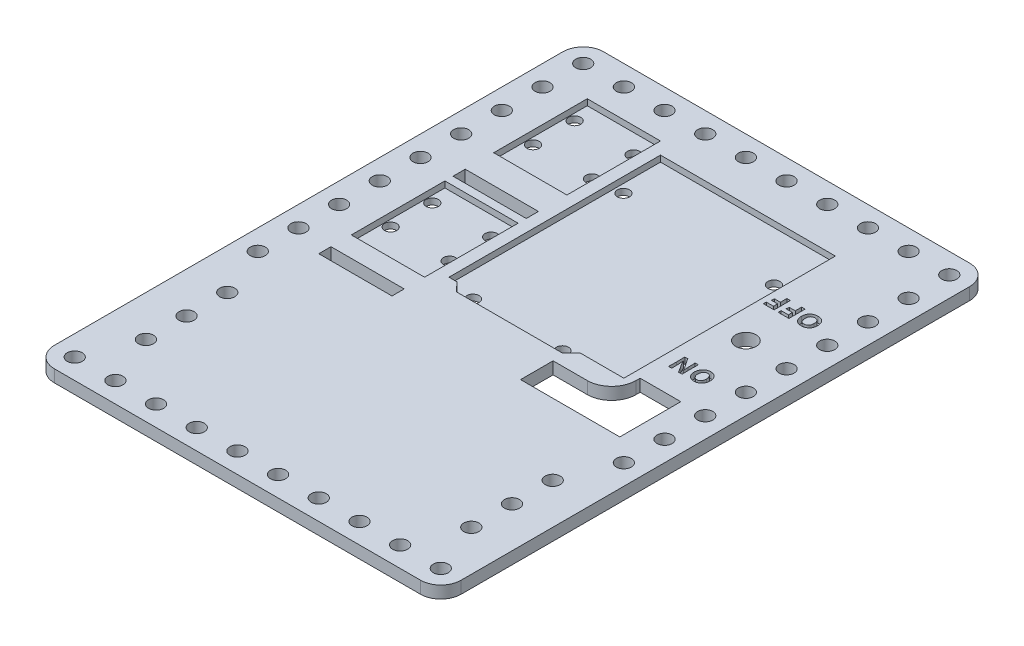
from build123d import *

# Parameters (mm, degrees)
PLATE_EXTRUDE_DEPTH               = 3.81
SKETCH2_R                         = 2.3495
OUTER_HOLE_CUT_DEPTH              = 214.397794272
SKETCH3_R                         = 1.905
ARDUINO_SHAPE_CUT_DEPTH           = 1.905
SKETCH4_W                         = 22.86
SKETCH4_H                         = 29.21
SKETCH4_R                         = 1.905
HG7881_SHAPE_CUT_DEPTH            = 1.905
SKETCH5_R                         = 1.905
ARDUINO_AND_HG7881_HOLE_CUT_DEPTH = 214.397794272
SKETCH6_R                         = 3.175
ON_OFF_TEXT_CUT_DEPTH             = 1.905
SKETCH8_R                         = 3.175
SWITCH_HOLE_CUT_DEPTH             = 214.372284013
BATTERY_WIRE_CUT_DEPTH            = 214.397794411
SKETCH10_W                        = 22.86
SKETCH10_H                        = 3.81
MOTOR_WIRE_CUT_DEPTH              = 214.397794411


with BuildPart() as part:
    # Sketch1 → Plate Extrude (new body)
    with BuildSketch(Plane(origin=(0, 0, 0), x_dir=(1, 0, 0), z_dir=(0, 1, 0))):
        with BuildLine():
            Line((6.35, 0), (120.65, 0))
            ThreePointArc((120.65, 0), (125.140128061, 1.859871939), (127, 6.35))
            Line((127, 6.35), (127, 165.1))
            ThreePointArc((127, 165.1), (125.140128061, 169.590128061), (120.65, 171.45))
            Line((120.65, 171.45), (6.35, 171.45))
            ThreePointArc((6.35, 171.45), (1.859871939, 169.590128061), (0, 165.1))
            Line((0, 165.1), (0, 6.35))
            ThreePointArc((0, 6.35), (1.859871939, 1.859871939), (6.35, 0))
        make_face()
    extrude(amount=PLATE_EXTRUDE_DEPTH)

    # Sketch2 → Outer Hole Cut (cut, through all)
    with BuildSketch(Plane(origin=(0, 3.81, 0), x_dir=(1, 0, 0), z_dir=(0, 1, 0))):
        with Locations((6.35, 165.1)):
            Circle(SKETCH2_R)
        with Locations((19.05, 165.1)):
            Circle(SKETCH2_R)
        with Locations((31.75, 165.1)):
            Circle(SKETCH2_R)
        with Locations((44.45, 165.1)):
            Circle(SKETCH2_R)
        with Locations((57.15, 165.1)):
            Circle(SKETCH2_R)
        with Locations((69.85, 165.1)):
            Circle(SKETCH2_R)
        with Locations((82.55, 165.1)):
            Circle(SKETCH2_R)
        with Locations((95.25, 165.1)):
            Circle(SKETCH2_R)
        with Locations((107.95, 165.1)):
            Circle(SKETCH2_R)
        with Locations((120.65, 165.1)):
            Circle(SKETCH2_R)
        with Locations((6.35, 152.4)):
            Circle(SKETCH2_R)
        with Locations((120.65, 152.4)):
            Circle(SKETCH2_R)
        with Locations((6.35, 139.7)):
            Circle(SKETCH2_R)
        with Locations((120.65, 139.7)):
            Circle(SKETCH2_R)
        with Locations((6.35, 127)):
            Circle(SKETCH2_R)
        with Locations((120.65, 127)):
            Circle(SKETCH2_R)
        with Locations((6.35, 114.3)):
            Circle(SKETCH2_R)
        with Locations((120.65, 114.3)):
            Circle(SKETCH2_R)
        with Locations((6.35, 101.6)):
            Circle(SKETCH2_R)
        with Locations((120.65, 101.6)):
            Circle(SKETCH2_R)
        with Locations((6.35, 88.9)):
            Circle(SKETCH2_R)
        with Locations((120.65, 88.9)):
            Circle(SKETCH2_R)
        with Locations((6.35, 76.2)):
            Circle(SKETCH2_R)
        with Locations((120.65, 76.2)):
            Circle(SKETCH2_R)
        with Locations((6.35, 63.5)):
            Circle(SKETCH2_R)
        with Locations((120.65, 63.5)):
            Circle(SKETCH2_R)
        with Locations((6.35, 6.35)):
            Circle(SKETCH2_R)
        with Locations((19.05, 6.35)):
            Circle(SKETCH2_R)
        with Locations((31.75, 6.35)):
            Circle(SKETCH2_R)
        with Locations((44.45, 6.35)):
            Circle(SKETCH2_R)
        with Locations((57.15, 6.35)):
            Circle(SKETCH2_R)
        with Locations((69.85, 6.35)):
            Circle(SKETCH2_R)
        with Locations((82.55, 6.35)):
            Circle(SKETCH2_R)
        with Locations((95.25, 6.35)):
            Circle(SKETCH2_R)
        with Locations((107.95, 6.35)):
            Circle(SKETCH2_R)
        with Locations((120.65, 6.35)):
            Circle(SKETCH2_R)
        with Locations((12.7, 22.225)):
            Circle(SKETCH2_R)
        with Locations((12.7, 34.925)):
            Circle(SKETCH2_R)
        with Locations((12.7, 47.625)):
            Circle(SKETCH2_R)
        with Locations((114.3, 47.625)):
            Circle(SKETCH2_R)
        with Locations((114.3, 34.925)):
            Circle(SKETCH2_R)
        with Locations((114.3, 22.225)):
            Circle(SKETCH2_R)
    extrude(amount=-OUTER_HOLE_CUT_DEPTH, mode=Mode.SUBTRACT)

    # Sketch3 → Arduino Shape Cut (cut)
    with BuildSketch(Plane(origin=(0, 3.81, 0), x_dir=(1, 0, 0), z_dir=(0, 1, 0))):
        Polygon((48.26, 83.566), (81.28, 83.566), (84.074, 86.36), (97.79, 86.36), (97.79, 152.4), (43.18, 152.4), (43.18, 86.36), (45.72, 86.36), align=None)
        with Locations((50.927, 86.106)):
            Circle(SKETCH3_R, mode=Mode.SUBTRACT)
        with Locations((78.867, 86.106)):
            Circle(SKETCH3_R, mode=Mode.SUBTRACT)
        with Locations((45.847, 138.176)):
            Circle(SKETCH3_R, mode=Mode.SUBTRACT)
        with Locations((94.107, 136.906)):
            Circle(SKETCH3_R, mode=Mode.SUBTRACT)
    extrude(amount=-ARDUINO_SHAPE_CUT_DEPTH, mode=Mode.SUBTRACT)

    # Sketch4 → HG7881 Shape Cut (cut)
    # profile 1 of 2: a face of its own
    with BuildSketch(Plane(origin=(0, 3.81, 0), x_dir=(1, 0, 0), z_dir=(0, 1, 0))):
        with Locations((27.94, 141.605)):
            Rectangle(SKETCH4_W, SKETCH4_H)
        with Locations((18.605695933, 137.183397888)):
            Circle(SKETCH4_R, mode=Mode.SUBTRACT)
        with Locations((18.605695933, 150.182885458)):
            Circle(SKETCH4_R, mode=Mode.SUBTRACT)
        with Locations((37.004970647, 137.183397888)):
            Circle(SKETCH4_R, mode=Mode.SUBTRACT)
        with Locations((37.004970647, 150.182885458)):
            Circle(SKETCH4_R, mode=Mode.SUBTRACT)
    # profile 2 of 2: a face of its own
    with BuildSketch(Plane(origin=(0, 3.81, 0), x_dir=(1, 0, 0), z_dir=(0, 1, 0))):
        with Locations((27.94, 97.155)):
            Rectangle(SKETCH4_W, SKETCH4_H)
        with Locations((18.605695933, 92.733397888)):
            Circle(SKETCH4_R, mode=Mode.SUBTRACT)
        with Locations((18.605695933, 105.732885458)):
            Circle(SKETCH4_R, mode=Mode.SUBTRACT)
        with Locations((37.004970647, 92.733397888)):
            Circle(SKETCH4_R, mode=Mode.SUBTRACT)
        with Locations((37.004970647, 105.732885458)):
            Circle(SKETCH4_R, mode=Mode.SUBTRACT)
    extrude(amount=-HG7881_SHAPE_CUT_DEPTH, mode=Mode.SUBTRACT)

    # Sketch5 → Arduino and HG7881 Hole Cut (cut, through all)
    with BuildSketch(Plane(origin=(0, 3.81, 0), x_dir=(1, 0, 0), z_dir=(0, 1, 0))):
        with Locations((94.107, 136.906)):
            Circle(SKETCH5_R)
        with Locations((78.867, 86.106)):
            Circle(SKETCH5_R)
        with Locations((50.927, 86.106)):
            Circle(SKETCH5_R)
        with Locations((45.847, 138.176)):
            Circle(SKETCH5_R)
        with Locations((18.605695933, 150.182885458)):
            Circle(SKETCH5_R)
        with Locations((37.004970647, 150.182885458)):
            Circle(SKETCH5_R)
        with Locations((37.004970647, 137.183397888)):
            Circle(SKETCH5_R)
        with Locations((18.605695933, 137.183397888)):
            Circle(SKETCH5_R)
        with Locations((18.605695933, 105.732885458)):
            Circle(SKETCH5_R)
        with Locations((18.605695933, 92.733397888)):
            Circle(SKETCH5_R)
        with Locations((37.004970647, 92.733397888)):
            Circle(SKETCH5_R)
        with Locations((37.004970647, 105.732885458)):
            Circle(SKETCH5_R)
    extrude(amount=-ARDUINO_AND_HG7881_HOLE_CUT_DEPTH, mode=Mode.SUBTRACT)

    # Sketch6 → On-Off Text Cut (cut)
    # profile 1 of 6: a face of its own
    with BuildSketch(Plane(origin=(0, 3.81, 0), x_dir=(1, 0, 0), z_dir=(0, 1, 0))):
        with Locations((106.68, 115.57)):
            Circle(SKETCH6_R)
    # profile 2 of 6: a face of its own
    with BuildSketch(Plane(origin=(0, 3.81, 0), x_dir=(1, 0, 0), z_dir=(0, 1, 0))):
        Polygon((99.437371429, 129.171473214), (101.693889286, 129.171473214), (101.693889286, 130.447142857), (99.727657143, 130.447142857), (99.853523214, 131.340678571), (101.693889286, 131.340678571), (101.693889286, 133.35), (102.775657143, 133.35), (102.775657143, 128.27), (99.437371429, 128.27), align=None)
    # profile 3 of 6: a face of its own
    with BuildSketch(Plane(origin=(0, 3.81, 0), x_dir=(1, 0, 0), z_dir=(0, 1, 0))):
        Polygon((104.067428571, 129.171473214), (106.323946429, 129.171473214), (106.323946429, 130.447142857), (104.357714286, 130.447142857), (104.483580357, 131.340678571), (106.323946429, 131.340678571), (106.323946429, 133.35), (107.405714286, 133.35), (107.405714286, 128.27), (104.067428571, 128.27), align=None)
    # profile 4 of 6: a face of its own
    with BuildSketch(Plane(origin=(0, 3.81, 0), x_dir=(1, 0, 0), z_dir=(0, 1, 0))):
        with BuildLine():
            add(Edge.make_bspline(
                [(111.333869643, 133.422571429), (111.400036429, 133.421293644), (111.530264052, 133.418778743), (111.721599638, 133.404606211), (111.905189704, 133.378126371), (112.080972714, 133.342085434), (112.249811922, 133.295795244), (112.410188822, 133.237757182), (112.56375482, 133.170889374), (112.708490415, 133.092309384), (112.845717814, 133.005237576), (112.974334881, 132.909432457), (113.094740592, 132.806319468), (113.206712713, 132.694912539), (113.308131412, 132.57405969), (113.403356697, 132.446908184), (113.488212662, 132.310484017), (113.563748165, 132.16604788), (113.632281169, 132.015770277), (113.689480318, 131.858408066), (113.739904415, 131.695888569), (113.780829795, 131.527040484), (113.81070706, 131.351870875), (113.83367303, 131.171457432), (113.847541782, 130.984842805), (113.849209369, 130.858404304), (113.850057143, 130.794125)],
                knots=[0, 0, 0, 0, 1.155951806, 2.27511212, 3.348946555, 4.393954723, 5.407965168, 6.404192186, 7.370925071, 8.331051299, 9.278033103, 10.207707961, 11.130132865, 12.045226557, 12.963364229, 13.883801961, 14.818154459, 15.766240508, 16.729630475, 17.701042071, 18.688919443, 19.701036391, 20.733368675, 21.791477785, 22.87722277, 24, 24, 24, 24], degree=3))
            add(Edge.make_bspline(
                [(113.850057143, 130.794125), (113.848906268, 130.723415676), (113.846650783, 130.584839579), (113.830807146, 130.381464541), (113.803655066, 130.186799958), (113.765464041, 130.000674458), (113.715246029, 129.823531722), (113.655605416, 129.654880626), (113.583465924, 129.495671763), (113.50234301, 129.345001737), (113.41108714, 129.204043311), (113.31226795, 129.072453114), (113.206641733, 128.94927541), (113.093327301, 128.835899312), (112.972520145, 128.732371499), (112.845157245, 128.638101242), (112.711122269, 128.552318363), (112.569123876, 128.478021474), (112.421764909, 128.412826257), (112.27068682, 128.354325345), (112.115299257, 128.305849976), (111.955941564, 128.265946605), (111.79235473, 128.23525646), (111.624564852, 128.214361204), (111.453183056, 128.19989699), (111.337679665, 128.198255989), (111.279441071, 128.197428571)],
                knots=[0, 0, 0, 0, 1.232878784, 2.416195216, 3.554230057, 4.658068463, 5.726311703, 6.762375074, 7.774173883, 8.770921373, 9.743472943, 10.699106932, 11.638420552, 12.570469205, 13.491194589, 14.409936463, 15.331416347, 16.263022172, 17.201202179, 18.139983866, 19.086323116, 20.037401017, 21.002982729, 21.986393442, 22.984708488, 24, 24, 24, 24], degree=3))
            add(Edge.make_bspline(
                [(111.279441071, 128.197428571), (111.213273297, 128.198699923), (111.083043727, 128.201202161), (110.891348755, 128.215493951), (110.707341451, 128.241734867), (110.531225731, 128.277979812), (110.362636424, 128.323918585), (110.20258477, 128.382788307), (110.048654743, 128.44877322), (109.903698075, 128.527726294), (109.766481954, 128.614787794), (109.637970949, 128.710263657), (109.518441812, 128.813624609), (109.408232239, 128.925490711), (109.305412098, 129.044563325), (109.21296982, 129.172923095), (109.128308478, 129.308838983), (109.052681555, 129.452532716), (108.985946638, 129.603423069), (108.927838811, 129.760537247), (108.879184775, 129.923835762), (108.840002216, 130.093242837), (108.807409716, 130.267881714), (108.786989966, 130.448664016), (108.772427389, 130.635137343), (108.770856008, 130.761589005), (108.770057143, 130.825875)],
                knots=[0, 0, 0, 0, 1.156696468, 2.276577743, 3.357644939, 4.403326298, 5.417989967, 6.408643156, 7.382049269, 8.342794008, 9.290385856, 10.22065961, 11.138675759, 12.049699079, 12.963401745, 13.885853181, 14.811705546, 15.76040235, 16.721714871, 17.693752249, 18.686672155, 19.697909826, 20.732068579, 21.790055059, 22.876499479, 24, 24, 24, 24], degree=3))
            add(Edge.make_bspline(
                [(108.770057143, 130.825875), (108.771206464, 130.89658476), (108.773458903, 131.035161713), (108.789324398, 131.238530612), (108.816397961, 131.433217244), (108.854774203, 131.618807699), (108.903794309, 131.795669576), (108.962645033, 131.964126231), (109.032386679, 132.12416686), (109.115110349, 132.274202466), (109.205284266, 132.415500429), (109.303290757, 132.547534618), (109.407831218, 132.670641911), (109.519985995, 132.784493228), (109.640747152, 132.887192812), (109.767111148, 132.982279292), (109.901099061, 133.067622997), (110.043041207, 133.141992923), (110.190413589, 133.207175556), (110.341494872, 133.265652887), (110.497206242, 133.314345793), (110.65703301, 133.353892206), (110.82058586, 133.384658176), (110.987980111, 133.405720988), (111.159372037, 133.420122315), (111.275253204, 133.421748733), (111.333869643, 133.422571429)],
                knots=[0, 0, 0, 0, 1.233852716, 2.418103927, 3.557037776, 4.661748176, 5.722706476, 6.757383218, 7.77332691, 8.765066384, 9.743935184, 10.696381236, 11.632146327, 12.56027906, 13.481731785, 14.395908616, 15.318116437, 16.250458198, 17.189379335, 18.128902627, 19.075989452, 20.034218859, 21.000563348, 21.978209187, 22.977312867, 24, 24, 24, 24], degree=3))
        make_face()
        with BuildLine():
            add(Edge.make_bspline(
                [(111.333869643, 132.513160714), (111.260356697, 132.511022486), (111.117541046, 132.506868489), (110.912228262, 132.467444284), (110.723064955, 132.404073163), (110.552376597, 132.313848715), (110.39951417, 132.200857268), (110.267975467, 132.064006418), (110.156626043, 131.905342044), (110.067891131, 131.725106566), (109.998896762, 131.526104278), (109.949508152, 131.310172001), (109.919816656, 131.076918765), (109.916108454, 130.915923571), (109.914191071, 130.832678571)],
                knots=[0, 0, 0, 0, 1.058829075, 2.057016769, 3.001336896, 3.925137105, 4.828608669, 5.730369611, 6.649529683, 7.612114954, 8.616840434, 9.679574342, 10.800188823, 12, 12, 12, 12], degree=3))
            add(Edge.make_bspline(
                [(109.914191071, 130.832678571), (109.915327037, 130.766878559), (109.917543635, 130.638483618), (109.933372092, 130.451336623), (109.959899959, 130.275341088), (109.999263424, 130.110717595), (110.046800586, 129.956526213), (110.107502436, 129.814047056), (110.178016873, 129.682400803), (110.259208826, 129.562263883), (110.351555025, 129.454397682), (110.455050487, 129.361321652), (110.568103557, 129.282339821), (110.691217371, 129.218037433), (110.82431679, 129.168601217), (110.967126702, 129.132058011), (111.120015541, 129.110232066), (111.225317862, 129.107991097), (111.279441071, 129.106839286)],
                knots=[0, 0, 0, 0, 1.264720188, 2.467836498, 3.607410022, 4.682410581, 5.718732818, 6.705184373, 7.654411213, 8.585417356, 9.486955331, 10.37694296, 11.253694391, 12.131137943, 13.039326412, 13.976802171, 14.960118255, 16, 16, 16, 16], degree=3))
            add(Edge.make_bspline(
                [(111.279441071, 129.106839286), (111.335835439, 129.107963805), (111.445660251, 129.110153743), (111.605130658, 129.132397386), (111.754467825, 129.1672814), (111.893827821, 129.215550644), (112.021826029, 129.279882734), (112.139532644, 129.357423365), (112.247188969, 129.448928353), (112.343643179, 129.554712323), (112.427774366, 129.673333586), (112.504124023, 129.800646126), (112.565732047, 129.940530934), (112.618197887, 130.089703369), (112.65751171, 130.249670935), (112.685693127, 130.419482433), (112.702863689, 130.59986961), (112.704886161, 130.723782964), (112.705923214, 130.787321429)],
                knots=[0, 0, 0, 0, 1.08085409, 2.104901632, 3.080636972, 4.018233257, 4.92584896, 5.820434128, 6.715107381, 7.628320538, 8.557700034, 9.499963439, 10.469947595, 11.483138428, 12.529113844, 13.62418888, 14.781766574, 16, 16, 16, 16], degree=3))
            add(Edge.make_bspline(
                [(112.705923214, 130.787321429), (112.704776361, 130.853119363), (112.702538517, 130.981510249), (112.686892008, 131.168313502), (112.659874426, 131.344207167), (112.621276707, 131.508645576), (112.57302335, 131.662624589), (112.512522447, 131.805334763), (112.441448923, 131.936960635), (112.359415567, 132.056716931), (112.267521316, 132.164582447), (112.163536671, 132.257359514), (112.051058988, 132.33815621), (111.926516373, 132.401844476), (111.79240037, 132.451433345), (111.648432164, 132.48792879), (111.494425971, 132.509768601), (111.388370919, 132.512009252), (111.333869643, 132.513160714)],
                knots=[0, 0, 0, 0, 1.261902195, 2.462337776, 3.592208748, 4.671870648, 5.698974068, 6.683227656, 7.640165232, 8.563109179, 9.462638388, 10.350642987, 11.229606108, 12.111523837, 13.024477649, 13.966889128, 14.955192282, 16, 16, 16, 16], degree=3))
        make_face(mode=Mode.SUBTRACT)
    # profile 5 of 6: a face of its own
    with BuildSketch(Plane(origin=(0, 3.81, 0), x_dir=(1, 0, 0), z_dir=(0, 1, 0))):
        with BuildLine():
            Line((101.571701087, 101.6), (102.551809783, 101.6))
            add(Edge.make_bspline(
                [(102.551809783, 101.6), (102.553079155, 101.591496576), (102.556215841, 101.570484157), (102.570664261, 101.534679948), (102.591082833, 101.487804539), (102.620097882, 101.430079145), (102.658760832, 101.362405041), (102.704449364, 101.283213598), (102.758562728, 101.193253978), (102.822069529, 101.093545151), (102.893671719, 100.982906434), (102.972802487, 100.86119078), (103.060135034, 100.728571416), (103.157336197, 100.586182156), (103.261555818, 100.432102311), (103.374428056, 100.267691579), (103.495412933, 100.092321927), (103.579399973, 99.972190914), (103.622797101, 99.910117754)],
                knots=[0, 0, 0, 0, 0.205231542, 0.507138232, 0.918114075, 1.43119293, 2.051657812, 2.783675886, 3.619500081, 4.564189586, 5.613081396, 6.773937471, 8.039102956, 9.413756019, 10.900431551, 12.49155187, 14.187142031, 16, 16, 16, 16], degree=3))
            add(Edge.make_bspline(
                [(103.622797101, 99.910117754), (103.668479586, 99.844199803), (103.757538516, 99.715691422), (103.887173245, 99.526789572), (104.007406999, 99.344779881), (104.121663036, 99.171557745), (104.227239447, 99.00548474), (104.32653222, 98.848337094), (104.417180624, 98.69839973), (104.50147074, 98.557301325), (104.577616504, 98.423347164), (104.64618625, 98.297520821), (104.708125137, 98.17985106), (104.760131227, 98.06952422), (104.807399208, 97.968188192), (104.844718413, 97.873750658), (104.876811856, 97.787843498), (104.892374368, 97.73220927), (104.899699275, 97.706023551)],
                knots=[0, 0, 0, 0, 1.506314367, 2.936590399, 4.302859661, 5.603249387, 6.833922843, 7.998884892, 9.094460789, 10.124569346, 11.085756043, 11.988160505, 12.816011405, 13.582674735, 14.278848772, 14.915439517, 15.489522948, 16, 16, 16, 16], degree=3))
            Line((104.899699275, 97.706023551), (104.961818841, 97.706023551))
            add(Edge.make_bspline(
                [(104.961818841, 97.706023551), (104.946818759, 97.845142891), (104.917636661, 98.115794366), (104.888472357, 98.512507451), (104.868464415, 98.888388717), (104.866259214, 99.132448729), (104.865188406, 99.250960145)],
                knots=[0, 0, 0, 0, 1.084104681, 2.109085131, 3.081803711, 4, 4, 4, 4], degree=3))
            add(Edge.make_bspline(
                [(104.865188406, 99.250960145), (104.864853394, 99.333402876), (104.864164663, 99.502892231), (104.86216003, 99.763653748), (104.857114562, 100.03781533), (104.851426739, 100.324640397), (104.844712712, 100.624901996), (104.835498142, 100.938190599), (104.823697584, 101.264872429), (104.81536631, 101.486882095), (104.811121377, 101.6)],
                knots=[0, 0, 0, 0, 0.842047515, 1.73111792, 2.663366491, 3.642676722, 4.661226829, 5.730878757, 6.843842049, 8, 8, 8, 8], degree=3))
            Line((104.811121377, 101.6), (105.807335145, 101.6))
            add(Edge.make_bspline(
                [(105.807335145, 101.6), (105.798340153, 101.393721964), (105.779902851, 100.97090777), (105.762420775, 100.32164218), (105.750178227, 99.642130778), (105.749177957, 99.179260189), (105.748666667, 98.942663043)],
                knots=[0, 0, 0, 0, 0.932070356, 1.910492186, 2.931944271, 4, 4, 4, 4], degree=3))
            add(Edge.make_bspline(
                [(105.748666667, 98.942663043), (105.748984022, 98.826092785), (105.749606211, 98.597551705), (105.751641037, 98.261636471), (105.756127683, 97.939137711), (105.763446337, 97.629703228), (105.770883425, 97.333256256), (105.781762949, 97.050292055), (105.792621981, 96.7806676), (105.802509207, 96.60549933), (105.807335145, 96.52)],
                knots=[0, 0, 0, 0, 1.154308935, 2.263073052, 3.326355064, 4.348015109, 5.328014083, 6.262712885, 7.152033157, 8, 8, 8, 8], degree=3))
            Line((105.807335145, 96.52), (104.613259058, 96.52))
            add(Edge.make_bspline(
                [(104.613259058, 96.52), (104.612465362, 96.530419236), (104.610608174, 96.554799443), (104.59732357, 96.594910597), (104.578967095, 96.644919777), (104.552277637, 96.704417668), (104.517132948, 96.773334817), (104.476051736, 96.852518395), (104.427307278, 96.941471412), (104.371588344, 97.04004313), (104.305826779, 97.147160894), (104.235690568, 97.265215372), (104.156690224, 97.392294054), (104.070432637, 97.529202621), (103.976568865, 97.675742049), (103.874805245, 97.831716708), (103.765421388, 97.997051653), (103.690272663, 98.110942949), (103.651556159, 98.169619565)],
                knots=[0, 0, 0, 0, 0.260950452, 0.610603898, 1.051316961, 1.597493103, 2.241864315, 2.989446012, 3.831961201, 4.782733297, 5.825518036, 6.980323617, 8.222547723, 9.573714243, 11.0339099, 12.581861888, 14.238980645, 16, 16, 16, 16], degree=3))
            add(Edge.make_bspline(
                [(103.651556159, 98.169619565), (103.610117445, 98.232105071), (103.528884883, 98.354595784), (103.410343654, 98.534293609), (103.300245503, 98.707563793), (103.195313826, 98.871665753), (103.097309299, 99.028369859), (103.006451259, 99.17733733), (102.923526743, 99.319626396), (102.846878643, 99.4534804), (102.776017402, 99.579270576), (102.712927248, 99.697504243), (102.656465292, 99.808486231), (102.60556953, 99.911165603), (102.562908939, 100.006864384), (102.5276216, 100.094608093), (102.496298031, 100.173696677), (102.481645329, 100.2251912), (102.474735507, 100.249474638)],
                knots=[0, 0, 0, 0, 1.50202595, 2.944430501, 4.312466267, 5.614511466, 6.846487252, 8.015042657, 9.109869109, 10.145562719, 11.105070242, 12.002023666, 12.829975823, 13.599528891, 14.297593606, 14.928102942, 15.494522073, 16, 16, 16, 16], degree=3))
            Line((102.474735507, 100.249474638), (102.416067029, 100.249474638))
            add(Edge.make_bspline(
                [(102.416067029, 100.249474638), (102.430056431, 100.108414982), (102.457289954, 99.833810564), (102.487565511, 99.432679123), (102.505575403, 99.053649821), (102.508047596, 98.808471711), (102.509246377, 98.689583333)],
                knots=[0, 0, 0, 0, 1.088029335, 2.118094371, 3.087452347, 4, 4, 4, 4], degree=3))
            add(Edge.make_bspline(
                [(102.509246377, 98.689583333), (102.509877649, 98.512037829), (102.511147116, 98.155000068), (102.522576159, 97.615854502), (102.537410559, 97.070092516), (102.554647542, 96.704034859), (102.563313406, 96.52)],
                knots=[0, 0, 0, 0, 0.981596616, 1.973956248, 2.981409976, 4, 4, 4, 4], degree=3))
            Line((102.563313406, 96.52), (101.571701087, 96.52))
            add(Edge.make_bspline(
                [(101.571701087, 96.52), (101.576027919, 96.603204113), (101.584939241, 96.774567039), (101.596554769, 97.039140764), (101.60571566, 97.319079444), (101.612252482, 97.61436467), (101.617973851, 97.924964695), (101.622897424, 98.250514409), (101.624806496, 98.591417), (101.625442679, 98.823792243), (101.625768116, 98.942663043)],
                knots=[0, 0, 0, 0, 0.825064104, 1.699259727, 2.622494583, 3.598657128, 4.624093957, 5.698826761, 6.822842305, 8, 8, 8, 8], degree=3))
            add(Edge.make_bspline(
                [(101.625768116, 98.942663043), (101.625439879, 99.063451119), (101.624790694, 99.302344985), (101.622868855, 99.656284206), (101.617901772, 100.001772538), (101.612213155, 100.338064097), (101.605568015, 100.665936849), (101.596431747, 100.984984082), (101.58474268, 101.295568541), (101.57600477, 101.49953862), (101.571701087, 101.6)],
                knots=[0, 0, 0, 0, 1.090597418, 2.156976447, 3.195727742, 4.210299034, 5.193782273, 6.156671367, 7.092105371, 8, 8, 8, 8], degree=3))
        make_face()
    # profile 6 of 6: a face of its own
    with BuildSketch(Plane(origin=(0, 3.81, 0), x_dir=(1, 0, 0), z_dir=(0, 1, 0))):
        with BuildLine():
            add(Edge.make_bspline(
                [(107.095971014, 98.956467391), (107.098038545, 99.052446973), (107.102088355, 99.240448563), (107.138082301, 99.515939157), (107.193530585, 99.779184697), (107.273236891, 100.030087927), (107.375994757, 100.268320132), (107.501995101, 100.493864353), (107.651373954, 100.706114628), (107.820705927, 100.904265075), (108.007386293, 101.083919763), (108.206322554, 101.242452231), (108.417086875, 101.375664025), (108.638286754, 101.484061209), (108.869511295, 101.570671222), (109.112575111, 101.629117994), (109.365913652, 101.668029128), (109.538807038, 101.671736851), (109.626768116, 101.673623188)],
                knots=[0, 0, 0, 0, 1.110003907, 2.174238483, 3.208849045, 4.21905918, 5.214618782, 6.205710215, 7.202652759, 8.212697272, 9.216731802, 10.195754822, 11.150873912, 12.095299873, 13.041381198, 14.001176956, 14.983080657, 16, 16, 16, 16], degree=3))
            add(Edge.make_bspline(
                [(109.626768116, 101.673623188), (109.710450436, 101.67126115), (109.874611999, 101.666627483), (110.11620657, 101.634587984), (110.346559347, 101.577214136), (110.567847064, 101.501045142), (110.776766692, 101.399360337), (110.976892254, 101.278150592), (111.164992241, 101.132493086), (111.341549596, 100.967098214), (111.503290126, 100.78577192), (111.644071043, 100.589318141), (111.763377018, 100.381245359), (111.860323823, 100.160922666), (111.936749287, 99.928707048), (111.990199949, 99.68394521), (112.023329869, 99.427495515), (112.026904388, 99.252596352), (112.028724638, 99.163532609)],
                knots=[0, 0, 0, 0, 1.033665759, 2.02776626, 3.003104485, 3.961843007, 4.913063737, 5.867569035, 6.847164971, 7.845813918, 8.852406623, 9.843523595, 10.825829756, 11.809813192, 12.811882314, 13.84042391, 14.90028102, 16, 16, 16, 16], degree=3))
            add(Edge.make_bspline(
                [(112.028724638, 99.163532609), (112.026654832, 99.067553968), (112.022600566, 98.87955422), (111.986638688, 98.604050364), (111.931073788, 98.34085305), (111.851742806, 98.089629553), (111.747359185, 97.851903249), (111.621419336, 97.626527521), (111.473523632, 97.413134279), (111.302745322, 97.21611659), (111.11629601, 97.036424917), (110.918261692, 96.877197339), (110.707571291, 96.744385705), (110.486418908, 96.635925511), (110.255181633, 96.549332393), (110.01212129, 96.490881013), (109.758781803, 96.451971134), (109.585888547, 96.448263237), (109.497927536, 96.446376812)],
                knots=[0, 0, 0, 0, 1.110098043, 2.174422874, 3.209121177, 4.219416985, 5.216829017, 6.208004501, 7.202491216, 8.215511247, 9.219630926, 10.195262581, 11.150462672, 12.094968727, 13.041130286, 14.001007442, 14.982994415, 16, 16, 16, 16], degree=3))
            add(Edge.make_bspline(
                [(109.497927536, 96.446376812), (109.414232424, 96.448691985), (109.250045767, 96.453233713), (109.008722487, 96.485926215), (108.777662801, 96.540848428), (108.557406356, 96.619607709), (108.347408432, 96.719440413), (108.147289323, 96.840145055), (107.959300855, 96.985948763), (107.781949856, 97.149815983), (107.621521036, 97.332380171), (107.480591086, 97.528332009), (107.36101928, 97.736713532), (107.264644742, 97.957662188), (107.187901159, 98.19012347), (107.134508425, 98.434909694), (107.101312679, 98.69173367), (107.097775861, 98.867018918), (107.095971014, 98.956467391)],
                knots=[0, 0, 0, 0, 1.03332865, 2.027104945, 3.001009176, 3.961012778, 4.909881577, 5.86812026, 6.840757482, 7.842544561, 8.845673591, 9.83646733, 10.818453131, 11.806448221, 12.808190538, 13.836396696, 14.895908154, 16, 16, 16, 16], degree=3))
        make_face()
        with BuildLine():
            add(Edge.make_bspline(
                [(108.200318841, 99.072653986), (108.201145221, 99.009321516), (108.202762148, 98.88540281), (108.223497198, 98.704818594), (108.25354153, 98.532915858), (108.299021078, 98.370788366), (108.355091262, 98.216915786), (108.424111107, 98.071978993), (108.507754565, 97.937496036), (108.601119268, 97.811828633), (108.706050946, 97.700577684), (108.81481794, 97.599875403), (108.932058338, 97.51696717), (109.054583796, 97.448374478), (109.183181397, 97.395196068), (109.317382772, 97.356774682), (109.457719058, 97.334939155), (109.55307205, 97.331566546), (109.601460145, 97.329855072)],
                knots=[0, 0, 0, 0, 1.216831025, 2.380897632, 3.489863252, 4.568249152, 5.613058355, 6.635127305, 7.647796248, 8.653249441, 9.639055523, 10.583653087, 11.497967932, 12.392213231, 13.277910895, 14.16691524, 15.069777711, 16, 16, 16, 16], degree=3))
            add(Edge.make_bspline(
                [(109.601460145, 97.329855072), (109.64679202, 97.331546544), (109.736067049, 97.33487767), (109.867556137, 97.357039364), (109.993754361, 97.394919169), (110.113665774, 97.449973662), (110.229168689, 97.518273516), (110.338433898, 97.603298967), (110.44349769, 97.702455009), (110.541400243, 97.81625829), (110.632395364, 97.940526288), (110.710195421, 98.075473123), (110.77649153, 98.218287435), (110.829971606, 98.369030326), (110.873206772, 98.527329378), (110.90229184, 98.69371901), (110.921593588, 98.867816853), (110.923436713, 98.986705855), (110.924376812, 99.047346014)],
                knots=[0, 0, 0, 0, 0.902754371, 1.777853262, 2.647603904, 3.519196709, 4.399346334, 5.314325575, 6.270542111, 7.272042485, 8.300124669, 9.333610479, 10.368928787, 11.43182187, 12.515581422, 13.63309649, 14.792744455, 16, 16, 16, 16], degree=3))
            add(Edge.make_bspline(
                [(110.924376812, 99.047346014), (110.922890884, 99.110270005), (110.919985047, 99.233322289), (110.901942481, 99.413871333), (110.869414521, 99.58486791), (110.826126597, 99.747654441), (110.768440125, 99.900896557), (110.69784744, 100.045018845), (110.616239973, 100.181036714), (110.520680169, 100.305466125), (110.4168244, 100.418302803), (110.307552117, 100.518994035), (110.19003061, 100.601713497), (110.068403664, 100.671539356), (109.940046696, 100.724995091), (109.806514514, 100.763051216), (109.666610731, 100.78515617), (109.571627955, 100.788461107), (109.523235507, 100.790144928)],
                knots=[0, 0, 0, 0, 1.210797462, 2.3677995, 3.486359933, 4.556649632, 5.604971398, 6.631173242, 7.640905167, 8.651714714, 9.643826094, 10.589272684, 11.504409335, 12.403069749, 13.282752155, 14.172555557, 15.068941607, 16, 16, 16, 16], degree=3))
            add(Edge.make_bspline(
                [(109.523235507, 100.790144928), (109.477885611, 100.788575032), (109.388509854, 100.785481075), (109.25721709, 100.761543515), (109.131274097, 100.72365991), (109.010381748, 100.670490971), (108.895916544, 100.600283922), (108.786225714, 100.515639957), (108.680875107, 100.416284035), (108.583244276, 100.301420209), (108.492984855, 100.176354764), (108.414095768, 100.042076018), (108.348541301, 99.899657941), (108.294464684, 99.749534016), (108.251534823, 99.591502598), (108.222390923, 99.425135539), (108.203147639, 99.251413094), (108.201272365, 99.132909644), (108.200318841, 99.072653986)],
                knots=[0, 0, 0, 0, 0.903167979, 1.779967091, 2.650116221, 3.518989718, 4.403478452, 5.318876904, 6.275531542, 7.28327132, 8.318020778, 9.3453814, 10.381174052, 11.437365587, 12.521621678, 13.63964875, 14.799828022, 16, 16, 16, 16], degree=3))
        make_face(mode=Mode.SUBTRACT)
    extrude(amount=-ON_OFF_TEXT_CUT_DEPTH, mode=Mode.SUBTRACT)

    # Sketch8 → Switch Hole Cut (cut, through all)
    with BuildSketch(Plane(origin=(0, 1.905, 0), x_dir=(1, 0, 0), z_dir=(0, 1, 0))):
        with Locations((106.68, 115.57)):
            Circle(SKETCH8_R)
    extrude(amount=-SWITCH_HOLE_CUT_DEPTH, mode=Mode.SUBTRACT)

    # Sketch9 → Battery Wire Cut (cut, through all)
    with BuildSketch(Plane(origin=(0, 3.81, 0), x_dir=(1, 0, 0), z_dir=(0, 1, 0))):
        with BuildLine():
            Line((113.03, 69.85), (82.044285714, 69.85))
            Line((82.044285714, 69.85), (82.044285714, 80.01))
            Line((82.044285714, 80.01), (92.71, 80.01))
            ThreePointArc((92.71, 80.01), (98.098153673, 82.241846327), (100.33, 87.63))
            Line((100.33, 87.63), (100.33, 88.9))
            Line((100.33, 88.9), (113.03, 88.9))
            Line((113.03, 88.9), (113.03, 69.85))
        make_face()
    extrude(amount=-BATTERY_WIRE_CUT_DEPTH, mode=Mode.SUBTRACT)

    # Sketch10 → Motor Wire Cut (cut, through all)
    with BuildSketch(Plane(origin=(0, 3.81, 0), x_dir=(1, 0, 0), z_dir=(0, 1, 0))):
        with Locations((27.94, 116.205)):
            Rectangle(SKETCH10_W, SKETCH10_H)
        with Locations((27.94, 74.295)):
            Rectangle(SKETCH10_W, SKETCH10_H)
    extrude(amount=-MOTOR_WIRE_CUT_DEPTH, mode=Mode.SUBTRACT)


solid = part.part
